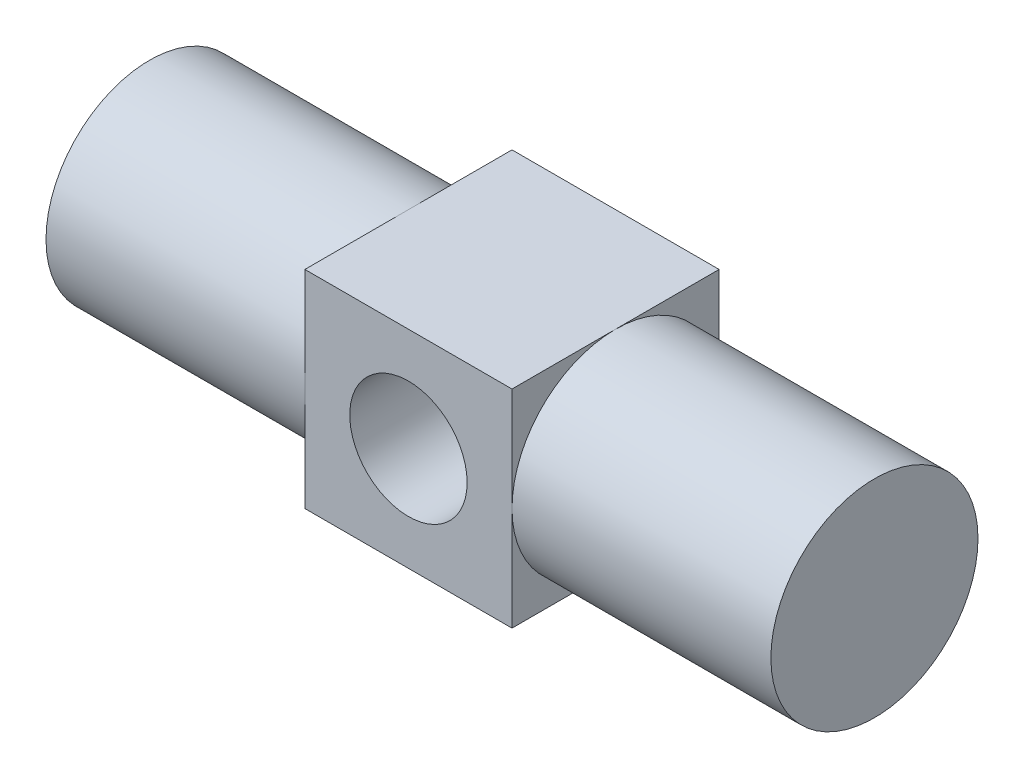
from build123d import *

# Parameters (mm, degrees)
SKETCH_1_W         = 12
SKETCH_1_H         = 12
EXTRUDE_1_DEPTH    = 6
SKETCH_2_R         = 6
EXTRUDE_2_DEPTH    = 15
HOLE_WIZARD_M8_1_D = 6.8


with BuildPart() as part:
    # 草图1 → 凸台-拉伸1 (new, symmetric)
    with BuildSketch(Plane.XY):
        Rectangle(SKETCH_1_W, SKETCH_1_H)
    extrude(amount=EXTRUDE_1_DEPTH, both=True)

    # 草图2 → 凸台-拉伸2 (add)
    with BuildSketch(Plane(origin=(6, 0, 0), x_dir=(0, 0, -1), z_dir=(1, 0, 0))):
        Circle(SKETCH_2_R)
    extrude_2 = extrude(amount=EXTRUDE_2_DEPTH)

    # 镜向1: 凸台-拉伸2 across plane
    add(extrude_2.mirror(Plane(origin=(0, 0, 0), x_dir=(0, 0, 1), z_dir=(1, 0, 0))))

    # M8 螺纹孔1 (through all)
    with Locations(Plane.XY.offset(6)):
        with Locations((0, 0)):
            Hole(HOLE_WIZARD_M8_1_D / 2)


solid = part.part
